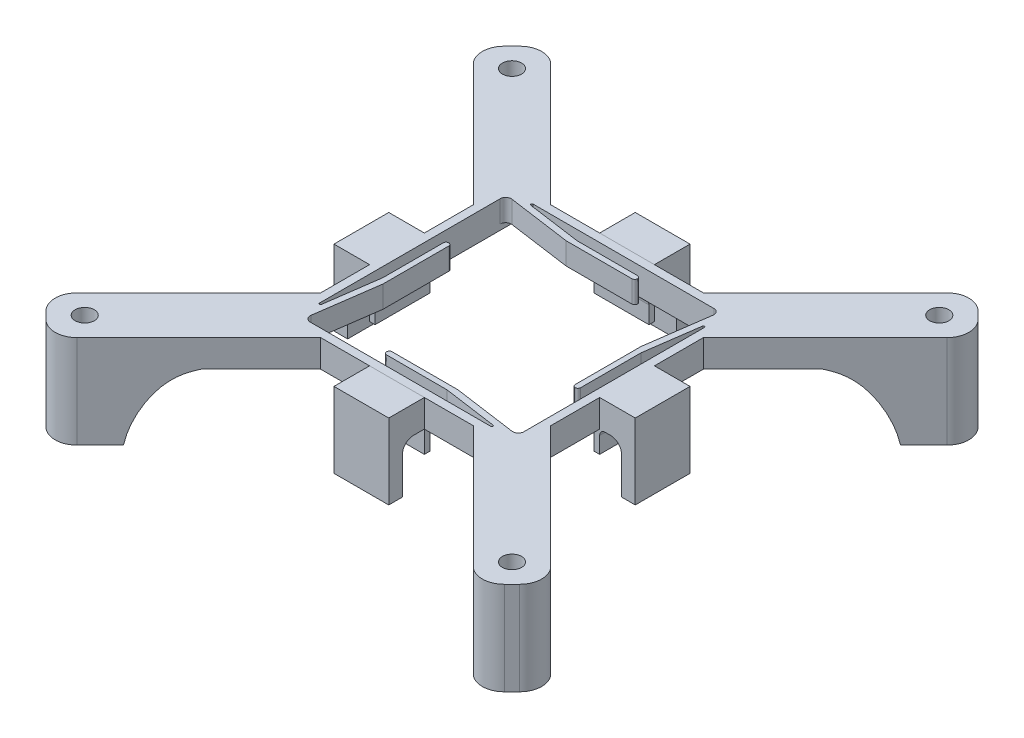
from build123d import *

# Parameters (mm, degrees)
SKETCH2_R              = 1.75
SKETCH2_W              = 39
SKETCH2_H              = 39
BOSS_EXTRUDE1_DEPTH    = 5
SKETCH3_W              = 10
SKETCH3_H              = 1
SKETCH3_W_2            = 1
SKETCH3_H_2            = 10
BOSS_EXTRUDE2_DEPTH    = 4
BOSS_EXTRUDE3_DEPTH    = 4
FILLET2_R              = 1
FILLET3_R              = 0.5
FILLET4_R              = 0.2
SKETCH5_W              = 39
SKETCH5_H              = 39
BOSS_EXTRUDE4_DEPTH    = 4
SKETCH6_R              = 3.75
BOSS_EXTRUDE5_DEPTH    = 2
BOSS_EXTRUDE5_2_DEPTH  = 2
BOSS_EXTRUDE5_3_DEPTH  = 2
BOSS_EXTRUDE5_4_DEPTH  = 2
BOSS_EXTRUDE6_START    = 20
SKETCH7_R              = 1.75
BOSS_EXTRUDE6_DEPTH    = 20
SKETCH10_R             = 16.495569138
BOSS_EXTRUDE7_DEPTH    = 14
SHELL1_T               = -2
FILLET5_R              = 2
BOSS_EXTRUDE8_START    = -10.000000001
BOSS_EXTRUDE8_DEPTH    = 10.000000001
CUT_EXTRUDE2_START     = -12
CUT_EXTRUDE2_OUTLINE_R = 1.75
CUT_EXTRUDE2_DEPTH     = 12
BOSS_EXTRUDE9_DEPTH    = 10
BOSS_EXTRUDE10_DEPTH   = 10
FILLET6_R              = 1
FILLET7_R              = 1
FILLET8_R              = 1
FILLET10_R             = 1


# Read off the part's stored shape, not the designer's step: Boss-Extrude8, Cut-Extrude2
# Some blends are built 0.0001 mm under size
with BuildPart() as part:
    # Sketch2 → Boss-Extrude1 (new body)
    with BuildSketch(Plane(origin=(0, 0, 0), x_dir=(1, 0, 0), z_dir=(0, 1, 0))):
        with BuildLine():
            Line((-21, -13.928932188), (-43.242640688, -36.171572875))
            ThreePointArc((-43.242640688, -36.171572875), (-44.414213563, -39), (-43.242640688, -41.828427124))
            Line((-43.242640688, -41.828427124), (-41.828427125, -43.242640687))
            ThreePointArc((-41.828427125, -43.242640687), (-39, -44.414213562), (-36.171572875, -43.242640687))
            Line((-36.171572875, -43.242640687), (-13.928932188, -21))
            Line((-13.928932188, -21), (13.928932188, -21))
            Line((13.928932188, -21), (36.171572875, -43.242640687))
            ThreePointArc((36.171572875, -43.242640687), (39, -44.414213562), (41.828427125, -43.242640687))
            Line((41.828427125, -43.242640687), (43.242640687, -41.828427125))
            ThreePointArc((43.242640687, -41.828427125), (44.414213562, -39), (43.242640687, -36.171572875))
            Line((43.242640687, -36.171572875), (21, -13.928932188))
            Line((21, -13.928932188), (21, 13.928932188))
            Line((21, 13.928932188), (43.242640687, 36.171572875))
            ThreePointArc((43.242640687, 36.171572875), (44.414213562, 39), (43.242640687, 41.828427125))
            Line((43.242640687, 41.828427125), (41.828427125, 43.242640687))
            ThreePointArc((41.828427125, 43.242640687), (39, 44.414213562), (36.171572875, 43.242640687))
            Line((36.171572875, 43.242640687), (13.928932188, 21))
            Line((13.928932188, 21), (-13.928932188, 21))
            Line((-13.928932188, 21), (-36.171572875, 43.242640687))
            ThreePointArc((-36.171572875, 43.242640687), (-39, 44.414213562), (-41.828427125, 43.242640687))
            Line((-41.828427125, 43.242640687), (-43.242640687, 41.828427125))
            ThreePointArc((-43.242640687, 41.828427125), (-44.414213562, 39), (-43.242640687, 36.171572875))
            Line((-43.242640687, 36.171572875), (-21, 13.928932188))
            Line((-21, 13.928932188), (-21, -13.928932188))
        make_face()
        with Locations(Location((-39, -39, 0), (0, 0, 270))):
            Circle(SKETCH2_R, mode=Mode.SUBTRACT)
        with Locations(Location((39, 39, 0), (0, 0, 270))):
            Circle(SKETCH2_R, mode=Mode.SUBTRACT)
        with Locations(Location((-39, 39, 0), (0, 0, 270))):
            Circle(SKETCH2_R, mode=Mode.SUBTRACT)
        with Locations(Location((39, -39, 0), (0, 0, 270))):
            Circle(SKETCH2_R, mode=Mode.SUBTRACT)
        Rectangle(SKETCH2_W, SKETCH2_H, mode=Mode.SUBTRACT)
    extrude(amount=BOSS_EXTRUDE1_DEPTH)

    # Sketch3 → Boss-Extrude2 (add)
    with BuildSketch(Plane.XZ):
        with Locations((0, 20.5)):
            Rectangle(SKETCH3_W, SKETCH3_H)
        with Locations((-20.5, 0)):
            Rectangle(SKETCH3_W_2, SKETCH3_H_2)
        with Locations((20.5, 0)):
            Rectangle(SKETCH3_W_2, SKETCH3_H_2)
        with Locations((0, -20.5)):
            Rectangle(SKETCH3_W, SKETCH3_H)
    extrude(amount=BOSS_EXTRUDE2_DEPTH)

    # Sketch4 → Boss-Extrude3 (add)
    with BuildSketch(Plane(origin=(0, 5, 0), x_dir=(1, 0, 0), z_dir=(0, 1, 0))):
        Polygon((-5.82456872, 17.718584308), (-18.5, 19.5), (-19.5, 19.5), (-19.5, 18.5), (-6.82456872, 16.718584308), (5.688784881, 16.718584308), (5.67543128, 17.718584308), align=None)
        Polygon((16.718584308, -5.67543128), (17.718584308, -5.67543128), (17.718584308, 5.82456872), (19.5, 18.5), (19.5, 19.5), (18.5, 19.5), (16.718584308, 6.82456872), align=None)
        Polygon((-16.718584308, -6.82456872), (-16.718584308, 5.67543128), (-17.718584308, 5.67543128), (-17.718584308, -5.82456872), (-19.5, -18.5), (-19.5, -19.5), (-18.5, -19.5), align=None)
        Polygon((-5.67543128, -16.718584307), (-5.67543128, -17.718584307), (5.82456872, -17.718584307), (18.5, -19.5), (19.5, -19.5), (19.5, -18.5), (6.82456872, -16.718584307), align=None)
    extrude(amount=-BOSS_EXTRUDE3_DEPTH)

    # Fillet2
    fillet2_edges = [part.edges().sort_by_distance(p)[0] for p in [
        (19.5, 3, 18.5),
        (-18.5, 3, 19.5),
        (18.5, 3, -19.5),
        (-19.5, 3, -18.5),
    ]]
    fillet(fillet2_edges, radius=FILLET2_R)

    # Fillet3
    fillet3_edges = [part.edges().sort_by_distance(p)[0] for p in [
        (-5.67543128, 3, 16.718584307),
        (-5.67543128, 3, 17.718584307),
        (17.718584308, 3, 5.67543128),
        (16.718584308, 3, 5.67543128),
        (5.688784881, 3, -16.718584308),
        (5.67543128, 3, -17.718584308),
        (-17.718584308, 3, -5.67543128),
        (-16.718584308, 3, -5.67543128),
    ]]
    fillet(fillet3_edges, radius=FILLET3_R - 0.0001)  # a hair under: the kernel refuses the full size

    # Fillet4
    fillet4_edges = [part.edges().sort_by_distance(p)[0] for p in [
        (18.5, 3, 19.5),
        (-19.5, 3, 18.5),
        (19.5, 3, -18.5),
        (-18.5, 3, -19.5),
    ]]
    fillet(fillet4_edges, radius=FILLET4_R)

    # Sketch15 → Boss-Extrude9 (add)
    with BuildSketch(Plane(origin=(0, 0, -5), x_dir=(-1, 0, 0), z_dir=(0, 0, -1))):
        with BuildLine():
            Line((21, 5), (21, 0))
            Line((21, 0), (23, 0))
            ThreePointArc((23, 0), (24.414213562, -0.585786438), (25, -2))
            Line((25, -2), (25, -8.75))
            Line((25, -8.75), (27.5, -8.75))
            Line((27.5, -8.75), (27.5, 5))
            Line((27.5, 5), (21, 5))
        make_face()
    boss_extrude9 = extrude(amount=-BOSS_EXTRUDE9_DEPTH)

    # Mirror11: Boss-Extrude9 across plane
    add(boss_extrude9.mirror(Plane(origin=(0, 0, 0), x_dir=(0, 0, 1), z_dir=(1, 0, 0))))


with BuildPart() as body_2:
    # Sketch5 → Boss-Extrude4 (new body)
    with BuildSketch(Plane.XZ.offset(4)):
        Rectangle(SKETCH5_W, SKETCH5_H)
    extrude(amount=-BOSS_EXTRUDE4_DEPTH)


with BuildPart() as body_3:
    # Sketch6 → Boss-Extrude5 (new body)
    with BuildSketch(Plane(origin=(0, 5, 0), x_dir=(1, 0, 0), z_dir=(0, 1, 0))):
        with Locations(Location((-39, 39, 0), (0, 0, 270))):
            Circle(SKETCH6_R)
    extrude(amount=BOSS_EXTRUDE5_DEPTH)



with BuildPart() as body_4:
    # Sketch6 → Boss-Extrude5 2 (new body)
    with BuildSketch(Plane(origin=(0, 5, 0), x_dir=(1, 0, 0), z_dir=(0, 1, 0))):
        with Locations(Location((39, 39, 0), (0, 0, 90))):
            Circle(SKETCH6_R)
    extrude(amount=BOSS_EXTRUDE5_2_DEPTH)


with BuildPart() as body_5:
    # Sketch6 → Boss-Extrude5 3 (new body)
    with BuildSketch(Plane(origin=(0, 5, 0), x_dir=(1, 0, 0), z_dir=(0, 1, 0))):
        with Locations(Location((-39, -39, 0), (0, 0, 90))):
            Circle(SKETCH6_R)
    extrude(amount=BOSS_EXTRUDE5_3_DEPTH)


with BuildPart() as body_6:
    # Sketch6 → Boss-Extrude5 4 (new body)
    with BuildSketch(Plane(origin=(0, 5, 0), x_dir=(1, 0, 0), z_dir=(0, 1, 0))):
        with Locations(Location((39, -39, 0), (0, 0, 270))):
            Circle(SKETCH6_R)
    extrude(amount=BOSS_EXTRUDE5_4_DEPTH)


with BuildPart() as body_3_1:
    add(body_3.part)

    add(body_4.part)  # Boss-Extrude6 merges body 4

    add(body_5.part)  # Boss-Extrude6 merges body 5

    add(body_6.part)  # Boss-Extrude6 merges body 6
    # Sketch7 → Boss-Extrude6 (add)
    with BuildSketch(Plane.XZ.offset(-5).offset(BOSS_EXTRUDE6_START)):
        with Locations(Location((-39, -39, 0), (0, 0, 90))):
            Circle(SKETCH7_R)
        with Locations(Location((-39, 39, 0), (0, 0, 90))):
            Circle(SKETCH7_R)
        with Locations(Location((39, 39, 0), (0, 0, 90))):
            Circle(SKETCH7_R)
        with Locations(Location((39, -39, 0), (0, 0, 90))):
            Circle(SKETCH7_R)
    extrude(amount=-BOSS_EXTRUDE6_DEPTH)


with BuildPart() as body_4_2:
    # Sketch10 → Boss-Extrude7 (new body)
    with BuildSketch(Plane(origin=(0, 0, 0), x_dir=(1, 0, 0), z_dir=(0, 1, 0))):
        with Locations(Location((0, 0, 0), (0, 0, 270))):
            Circle(SKETCH10_R)
    extrude(amount=BOSS_EXTRUDE7_DEPTH)

    # Shell1
    shell1_openings = [body_4_2.faces().sort_by_distance(p)[0] for p in [
        (0, 14, 0),
    ]]
    offset(amount=SHELL1_T, openings=shell1_openings, kind=Kind.INTERSECTION)

    # Fillet5
    fillet5_edges = [body_4_2.edges().sort_by_distance(p)[0] for p in [
        (0, 0, -16.495569138),
    ]]
    fillet(fillet5_edges, radius=FILLET5_R)


with BuildPart() as body_5_2:
    # Boss-Extrude8 outline → Boss-Extrude8 (new body)
    with BuildSketch(Plane(origin=(3.535533906, 0, 3.535533906), x_dir=(0.7071067811865404, 0, -0.7071067811865547), z_dir=(0.7071067811865547, 0, 0.7071067811865404)).offset(BOSS_EXTRUDE8_START)):
        with BuildLine():
            Line((-60.154328933, -12), (-50.154328933, -12))
            add(Edge.make_bspline(
                [(-50.154328933, -12), (-49.438172552, -8.15289655), (-47.626330996, -5), (-45.45212113, -2.234214136), (-43.600016429, -0.865267184), (-40.154328933, 0)],
                knots=[0, 0, 0, 0, 0, 0, 1, 1, 1, 1, 1, 1], degree=5))
            Line((-40.154328933, 0), (-60.154328933, 0))
            Line((-60.154328933, 0), (-60.154328933, -12))
        make_face()
    extrude(amount=BOSS_EXTRUDE8_DEPTH)

    # Cut-Extrude2 outline → Cut-Extrude2 (cut)
    with BuildSketch(Plane(origin=(0, 0, 0), x_dir=(1, 0, 0), z_dir=(0, 1, 0)).offset(CUT_EXTRUDE2_START)):
        with BuildLine():
            ThreePointArc((-36.171572875, -43.242640687), (-39, -44.414213562), (-41.828427125, -43.242640687))
            Line((-41.828427125, -43.242640687), (-39, -46.071067812))
            Line((-39, -46.071067812), (-36.171572875, -43.242640687))
        make_face()
        with BuildLine():
            ThreePointArc((-43.242640688, -41.828427124), (-44.414213563, -39), (-43.242640688, -36.171572875))
            Line((-43.242640688, -36.171572875), (-46.071067812, -39))
            Line((-46.071067812, -39), (-43.242640688, -41.828427124))
        make_face()
        with Locations((-39, -39)):
            Circle(CUT_EXTRUDE2_OUTLINE_R)
    extrude(amount=CUT_EXTRUDE2_DEPTH, mode=Mode.SUBTRACT)


with BuildPart() as body_6_2:
    # Mirror7: mirrored copy
    add(body_5_2.part.mirror(Plane(origin=(0, 0, 0), x_dir=(0, 0, 1), z_dir=(1, 0, 0))))


with BuildPart() as body_7:
    # Mirror10: mirrored copy
    add(body_5_2.part.mirror(Plane.XY))


with BuildPart() as body_8:
    # Mirror10 2: mirrored copy
    add(body_6_2.part.mirror(Plane.XY))


with BuildPart() as body_6_3:
    # Sketch17 → Boss-Extrude10 (new body)
    with BuildSketch(Plane(origin=(5, 0, 0), x_dir=(0, 0, -1), z_dir=(1, 0, 0))):
        with BuildLine():
            Line((21, 5), (21, 0))
            Line((21, 0), (23, 0))
            ThreePointArc((23, 0), (24.414213562, -0.585786438), (25, -2))
            Line((25, -2), (25, -8.75))
            Line((25, -8.75), (27.5, -8.75))
            Line((27.5, -8.75), (27.5, 5))
            Line((27.5, 5), (26.25, 5))
            Line((26.25, 5), (21, 5))
        make_face()
    extrude(amount=-BOSS_EXTRUDE10_DEPTH)


with BuildPart() as body_7_2:
    # Mirror13: mirrored copy
    add(body_6_3.part.mirror(Plane.XY))


with BuildPart() as body_7_1:
    add(body_7.part)

    # Combine1: union body 5 2, part, body 6 2, body 8
    add(body_5_2.part)
    add(part.part)
    add(body_6_2.part)
    add(body_8.part)

    # Fillet6
    # the kernel refuses this fillet: 1 mm, written as the material it adds along each edge
    with BuildSketch(Plane(origin=(-21, 0, -5), x_dir=(0, -1, 0), z_dir=(0, 0, 1))) as fillet6_piece_1:
        with BuildLine():
            CenterArc((FILLET6_R, -FILLET6_R), FILLET6_R, 90, 90)
            Line((0, -FILLET6_R), (0, 0))
            Line((0, 0), (FILLET6_R, 0))
        make_face()
    extrude(amount=10)
    with BuildSketch(Plane(origin=(21, 0, -5), x_dir=(-3.2248337333840027e-10, -1.0, 0), z_dir=(0, 0, 1))) as fillet6_piece_2:
        with BuildLine():
            CenterArc((FILLET6_R, FILLET6_R), FILLET6_R, 180.000000018, 90)
            Line((-FILLET6_R * 3.22483373234e-10, FILLET6_R), (0, 0))
            Line((0, 0), (FILLET6_R, 0))
        make_face()
    extrude(amount=10)

    # Fillet7
    # the kernel refuses this fillet: 1 mm, written as the material it adds along each edge
    with BuildSketch(Plane(origin=(20, 0, 5), x_dir=(0, -1, 0), z_dir=(0, 0, -1))) as fillet7_piece_1:
        with BuildLine():
            CenterArc((0.866025404, 1), FILLET7_R, 209.999999996, 60.000000004)
            Line((0, 0.5), (-0.017320508, 0.49))
            ThreePointArc((-0.017320508, 0.49), (-0.02, 0.25), (-0.02, 0))
            Line((-0.02, 0), (0, -0.02))
            Line((0, -0.02), (0.866025404, -0.02))
            Line((0.866025404, -0.02), (0.866025404, 0))
        make_face()
    extrude(amount=10)

    # Fillet8
    # the kernel refuses this fillet: 1 mm, written as the material it adds along each edge
    with BuildSketch(Plane(origin=(5, 0, 20), x_dir=(0, -1, 0), z_dir=(-1, 0, 0)), Plane(origin=(-20, 0, 5), x_dir=(0, -1, 0), z_dir=(0, 0, -1))) as fillet8_piece_1:
        with BuildLine():
            CenterArc((0.866025404, -1), FILLET8_R, 90, 60.000000017)
            Line((0, -0.5), (-0.017320508, -0.49))
            ThreePointArc((-0.017320508, -0.49), (-0.02, -0.25), (-0.02, 0))
            Line((-0.02, 0), (0, 0.02))
            Line((0, 0.02), (0.866025404, 0.02))
            Line((0.866025404, 0.02), (0.866025404, 0))
        make_face()
    extrude(amount=10)

    # Fillet10
    # the kernel refuses this fillet: 1 mm, written as the material it adds along each edge
    with BuildSketch(Plane(origin=(5, 0, -20), x_dir=(0, -1, 0), z_dir=(-1, 0, 0))) as fillet10_piece_1:
        with BuildLine():
            CenterArc((0.866025404, 1), FILLET10_R, 210.000000007, 59.999999993)
            Line((0, 0.5), (-0.017320508, 0.49))
            ThreePointArc((-0.017320508, 0.49), (-0.02, 0.25), (-0.02, 0))
            Line((-0.02, 0), (0, -0.02))
            Line((0, -0.02), (0.866025404, -0.02))
            Line((0.866025404, -0.02), (0.866025404, 0))
        make_face()
    extrude(amount=10)


solid = Compound([body_6_3.part, body_7_2.part, body_7_1.part])
